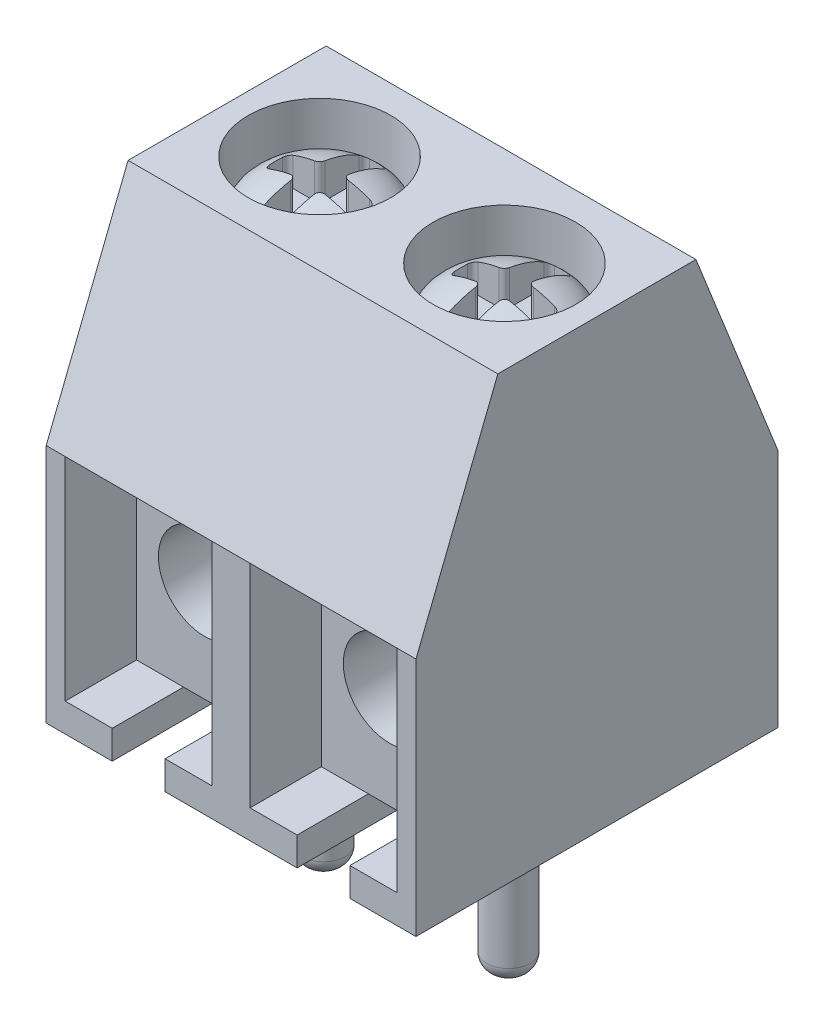
from build123d import *

# Parameters (mm, degrees)
BOSS_EXTRUDE1_DEPTH = 3.5
CUT_EXTRUDE1_DEPTH  = 3.5
SKETCH3_R           = 0.5
CUT_EXTRUDE2_DEPTH  = 0.54
SKETCH4_W           = 2.58
SKETCH4_H           = 3.81
SKETCH4_R           = 0.875
BOSS_EXTRUDE2_DEPTH = 2.25
SKETCH5_R           = 0.41
BOSS_EXTRUDE3_DEPTH = 3.8
FILLET1_R           = 0.3
SKETCH6_R           = 1.35
CUT_EXTRUDE4_DEPTH  = 2
CUT_EXTRUDE5_DEPTH  = 1


# Read off the part's stored shape, not the designer's step: Revolve1
with BuildPart() as part:
    # Sketch1 → Boss-Extrude1 (new, symmetric)
    with BuildSketch(Plane(origin=(0, 0, 0), x_dir=(0, 0, -1), z_dir=(1, 0, 0))):
        Polygon((3.425, -4.225), (-3.425, -4.225), (-3.425, 0.325), (-1.875, 4.225), (1.875, 4.225), (3.425, 0.325), align=None)
    extrude(amount=BOSS_EXTRUDE1_DEPTH, both=True)

    # Sketch2 → Cut-Extrude1 (cut)
    with BuildSketch(Plane.XY.offset(3.425)):
        Polygon((-2.25, -4.225), (-2.25, -3.685), (-3.14, -3.685), (-3.14, 0.325), (-0.36, 0.325), (-0.36, -3.685), (-1.25, -3.685), (-1.25, -4.225), align=None)
        Polygon((2.25, -4.225), (1.25, -4.225), (1.25, -3.685), (0.36, -3.685), (0.36, 0.325), (3.14, 0.325), (3.14, -3.685), (2.25, -3.685), align=None)
    extrude(amount=-CUT_EXTRUDE1_DEPTH, mode=Mode.SUBTRACT)

    # Sketch3 → Cut-Extrude2 (cut)
    with BuildSketch(Plane.XZ.offset(4.225)):
        with Locations((-1.75, -0.075)):
            Circle(SKETCH3_R)
        with Locations((1.75, -0.075)):
            Circle(SKETCH3_R)
    extrude(amount=-CUT_EXTRUDE2_DEPTH, mode=Mode.SUBTRACT)

    # Sketch4 → Boss-Extrude2 (add)
    # profile 1 of 2: a face of its own
    with BuildSketch(Plane.XY.offset(-0.075)):
        with Locations((-1.75, -1.68)):
            Rectangle(SKETCH4_W, SKETCH4_H)
        with Locations(Location((-1.75, -1.68, 0), (0, 0, 180))):
            Circle(SKETCH4_R, mode=Mode.SUBTRACT)
    # profile 2 of 2: a face of its own
    with BuildSketch(Plane.XY.offset(-0.075)):
        with Locations((1.75, -1.68)):
            Rectangle(SKETCH4_W, SKETCH4_H)
        with Locations(Location((1.75, -1.68, 0), (0, 0, 180))):
            Circle(SKETCH4_R, mode=Mode.SUBTRACT)
    extrude(amount=BOSS_EXTRUDE2_DEPTH)

    # Sketch5 → Boss-Extrude3 (add)
    with BuildSketch(Plane.XZ.offset(3.585)):
        with Locations(Location((-1.75, -0.075, 0), (0, 0, 180))):
            Circle(SKETCH5_R)
        with Locations(Location((1.75, -0.075, 0), (0, 0, 180))):
            Circle(SKETCH5_R)
    extrude(amount=BOSS_EXTRUDE3_DEPTH)

    # Fillet1
    fillet1_edges = [part.edges().sort_by_distance(p)[0] for p in [
        (-1.34, -7.385, -0.075),
        (2.16, -7.385, -0.075),
    ]]
    fillet(fillet1_edges, radius=FILLET1_R)

    # Sketch6 → Cut-Extrude4 (cut)
    with BuildSketch(Plane(origin=(0, 4.225, 0), x_dir=(1, 0, 0), z_dir=(0, 1, 0))):
        with Locations(Location((-1.75, 0, 0), (0, 0, 270))):
            Circle(SKETCH6_R)
        with Locations(Location((1.75, 0, 0), (0, 0, 90))):
            Circle(SKETCH6_R)
    extrude(amount=-CUT_EXTRUDE4_DEPTH, mode=Mode.SUBTRACT)

    # Revolve1 outline → Revolve1 (revolve)
    with BuildSketch(Plane(origin=(-1.75, 0, 0), x_dir=(1, 0, 0), z_dir=(0, 0, 1))):
        with BuildLine():
            add(Edge.make_bspline(
                [(1.25, 3.275), (1.25, 3.675), (0.48978488, 3.925), (0, 3.925)],
                knots=[0, 0, 0, 0, 1, 1, 1, 1], degree=3))
            Line((0, 3.925), (0, 2.225))
            Line((0, 2.225), (0.6, 2.225))
            Line((0.6, 2.225), (0.6, 2.975))
            Line((0.6, 2.975), (1.25, 2.975))
            Line((1.25, 2.975), (1.25, 3.275))
        make_face()
    revolve1 = revolve(axis=Axis((-1.75, 0, 0), (0, 1, 0)))

    # Sketch8 → Cut-Extrude5 (cut)
    with BuildSketch(Plane(origin=(0, 4.225, 0), x_dir=(1, 0, 0), z_dir=(0, 1, 0))):
        with BuildLine():
            Line((-1.625, 1.075), (-1.875, 1.075))
            ThreePointArc((-1.875, 1.075), (-1.945710678, 1.045710678), (-1.975, 0.975))
            Line((-1.975, 0.975), (-1.975, 0.325))
            ThreePointArc((-1.975, 0.325), (-2.004289322, 0.254289322), (-2.075, 0.225))
            Line((-2.075, 0.225), (-2.475, 0.225))
            ThreePointArc((-2.475, 0.225), (-2.545710678, 0.195710678), (-2.575, 0.125))
            Line((-2.575, 0.125), (-2.575, -0.125))
            ThreePointArc((-2.575, -0.125), (-2.545710678, -0.195710678), (-2.475, -0.225))
            Line((-2.475, -0.225), (-2.075, -0.225))
            ThreePointArc((-2.075, -0.225), (-2.004289322, -0.254289322), (-1.975, -0.325))
            Line((-1.975, -0.325), (-1.975, -0.975))
            ThreePointArc((-1.975, -0.975), (-1.945710678, -1.045710678), (-1.875, -1.075))
            Line((-1.875, -1.075), (-1.625, -1.075))
            ThreePointArc((-1.625, -1.075), (-1.554289322, -1.045710678), (-1.525, -0.975))
            Line((-1.525, -0.975), (-1.525, -0.325))
            ThreePointArc((-1.525, -0.325), (-1.495710678, -0.254289322), (-1.425, -0.225))
            Line((-1.425, -0.225), (-1.025, -0.225))
            ThreePointArc((-1.025, -0.225), (-0.954289322, -0.195710678), (-0.925, -0.125))
            Line((-0.925, -0.125), (-0.925, 0.125))
            ThreePointArc((-0.925, 0.125), (-0.954289322, 0.195710678), (-1.025, 0.225))
            Line((-1.025, 0.225), (-1.425, 0.225))
            ThreePointArc((-1.425, 0.225), (-1.495710678, 0.254289322), (-1.525, 0.325))
            Line((-1.525, 0.325), (-1.525, 0.975))
            ThreePointArc((-1.525, 0.975), (-1.554289322, 1.045710678), (-1.625, 1.075))
        make_face()
    cut_extrude5 = extrude(amount=-CUT_EXTRUDE5_DEPTH, mode=Mode.SUBTRACT)

    # Mirror1: Revolve1, Cut-Extrude5 across plane
    add(revolve1.mirror(Plane(origin=(0, 0, 0), x_dir=(0, 0, 1), z_dir=(1, 0, 0))))
    add(cut_extrude5.mirror(Plane(origin=(0, 0, 0), x_dir=(0, 0, 1), z_dir=(1, 0, 0))), mode=Mode.SUBTRACT)


solid = part.part
